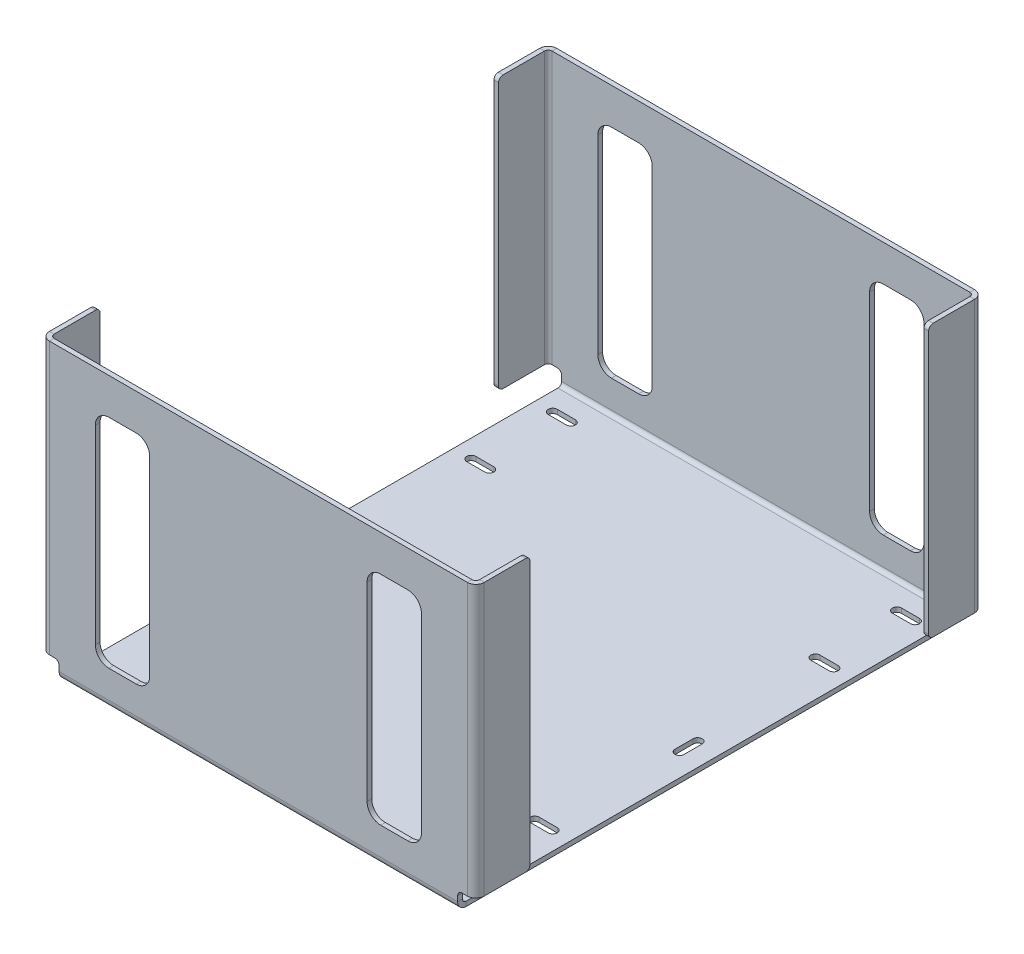
from build123d import *

# Parameters (mm, degrees)
SKETCH1_W                       = 279.4
SKETCH1_H                       = 355.6
BASE_FLANGE1_DEPTH              = 3.2766
EDGE_FLANGE1_STRIP_W            = 18.42008
EDGE_FLANGE1_STRIP_H            = 3.2766
EDGE_FLANGE1_STRIP_CUT_DEPTH    = 279.4
EDGE_FLANGE1_STRIP_2_W          = 18.42008
EDGE_FLANGE1_STRIP_2_H          = 3.2766
EDGE_FLANGE1_STRIP_CUT_2_DEPTH  = 279.4
EDGE_FLANGE1_DEPTH              = 279.4
EDGE_FLANGE1_FLAT_DEPTH         = 3.2766
EDGE_FLANGE1_BEND_DEPTH         = 279.4
EDGE_FLANGE1_FLAT_2_DEPTH       = 3.2766
EDGE_FLANGE2_STRIP_W            = 18.42008
EDGE_FLANGE2_STRIP_H            = 3.2766
EDGE_FLANGE2_STRIP_CUT_DEPTH    = 190.5
EDGE_FLANGE2_STRIP_2_W          = 18.42008
EDGE_FLANGE2_STRIP_2_H          = 3.2766
EDGE_FLANGE2_STRIP_CUT_2_DEPTH  = 190.5
EDGE_FLANGE2_STRIP_3_W          = 18.42008
EDGE_FLANGE2_STRIP_3_H          = 3.2766
EDGE_FLANGE2_STRIP_CUT_3_DEPTH  = 190.5
EDGE_FLANGE2_STRIP_4_W          = 18.42008
EDGE_FLANGE2_STRIP_4_H          = 3.2766
EDGE_FLANGE2_STRIP_CUT_4_DEPTH  = 190.5
EDGE_FLANGE2_DEPTH              = 190.5
EDGE_FLANGE2_BEND_DEPTH         = 190.5
EDGE_FLANGE2_BEND_2_DEPTH       = 190.5
EDGE_FLANGE2_BEND_3_DEPTH       = 190.5
SKETCH34_W                      = 38.1
SKETCH34_H                      = 152.4
CUT_EXTRUDE1_DEPTH              = 436.484197035
FILLET1_R                       = 9.525
FILLET2_R                       = 3.175
F_1_4_START                     = -3.2766
F_1_4_0_25_DIAMETER_SLOT1_DEPTH = 3.2766
LPATTERN1_COUNT                 = 2
LPATTERN1_PITCH                 = 57.15
MIRROR1_START                   = -3.2766
MIRROR1_COPY_1_DEPTH            = 3.2766
F_1_4_0_25_DIAMETER_SLOT2_DEPTH = 3.2766


# Read off the part's stored shape, not the designer's step: 1/4 (0.25) Diameter Slot1, 1/4 (0.25) Diameter Slot2
# Sheet-metal steps are written as plain solids
with BuildPart() as part:
    # Sketch1 → Base-Flange1 (new body)
    with BuildSketch(Plane(origin=(0, 0, 0), x_dir=(1, 0, 0), z_dir=(0, 1, 0))):
        Rectangle(SKETCH1_W, SKETCH1_H)
    extrude(amount=-BASE_FLANGE1_DEPTH)

    # Edge-Flange1 strip (across the edge) → Edge-Flange1 strip cut (cut)
    with BuildSketch(Plane(origin=(-139.7, 0, 177.8), x_dir=(0, 0, -1), z_dir=(1, 0, 0))):
        with Locations((-3.2766, -1.6383)):
            Rectangle(EDGE_FLANGE1_STRIP_W, EDGE_FLANGE1_STRIP_H)
    extrude(amount=EDGE_FLANGE1_STRIP_CUT_DEPTH, mode=Mode.SUBTRACT)

    # Edge-Flange1 strip 2 (across the edge) → Edge-Flange1 strip cut 2 (cut)
    with BuildSketch(Plane(origin=(139.7, 0, -177.8), x_dir=(0, 0, 1), z_dir=(-1, 0, 0))):
        with Locations((-3.2766, -1.6383)):
            Rectangle(EDGE_FLANGE1_STRIP_2_W, EDGE_FLANGE1_STRIP_2_H)
    extrude(amount=EDGE_FLANGE1_STRIP_CUT_2_DEPTH, mode=Mode.SUBTRACT)

    # Edge-Flange1 bend section (across the edge) → Edge-Flange1 (add)
    with BuildSketch(Plane(origin=(-139.7, 0, 177.8), x_dir=(0, 0, -1), z_dir=(1, 0, 0))):
        with BuildLine():
            Line((0, 2.65684), (3.2766, 2.65684))
            ThreePointArc((3.2766, 2.65684), (4.054770419, 0.778170419), (5.93344, 0))
            Line((5.93344, 0), (5.93344, -3.2766))
            ThreePointArc((5.93344, -3.2766), (1.73786434, -1.53873566), (0, 2.65684))
        make_face()
    extrude(amount=EDGE_FLANGE1_DEPTH)

    # Edge-Flange1 profile (on flange) → Edge-Flange1 flat (add)
    with BuildSketch(Plane.XY.offset(177.8)):
        Polygon((-139.7, 2.65684), (139.7, 2.65684), (139.7, 9.4234), (152.4, 9.4234), (152.4, 199.9234), (-152.4, 199.9234), (-152.4, 9.4234), (-139.7, 9.4234), align=None)
    extrude(amount=-EDGE_FLANGE1_FLAT_DEPTH)

    # Edge-Flange1 bend section 2 (across the edge) → Edge-Flange1 bend (add)
    with BuildSketch(Plane(origin=(139.7, 0, -177.8), x_dir=(0, 0, 1), z_dir=(-1, 0, 0))):
        with BuildLine():
            Line((0, 2.65684), (3.2766, 2.65684))
            ThreePointArc((3.2766, 2.65684), (4.054770419, 0.778170419), (5.93344, 0))
            Line((5.93344, 0), (5.93344, -3.2766))
            ThreePointArc((5.93344, -3.2766), (1.73786434, -1.53873566), (0, 2.65684))
        make_face()
    extrude(amount=EDGE_FLANGE1_BEND_DEPTH)

    # Edge-Flange1 profile 2 (on flange) → Edge-Flange1 flat 2 (add)
    with BuildSketch(Plane(origin=(0, 0, -177.8), x_dir=(-1, 0, 0), z_dir=(0, 0, -1))):
        Polygon((-139.7, 9.4234), (-139.7, 2.65684), (139.7, 2.65684), (139.7, 9.4234), (152.4, 9.4234), (152.4, 199.9234), (-152.4, 199.9234), (-152.4, 9.4234), align=None)
    extrude(amount=-EDGE_FLANGE1_FLAT_2_DEPTH)

    # Edge-Flange2 strip (across the edge) → Edge-Flange2 strip cut (cut)
    with BuildSketch(Plane(origin=(-152.4, 9.4234, 174.5234), x_dir=(1, 0, 0), z_dir=(0, 1, 0))):
        with Locations((-3.2766, -1.6383)):
            Rectangle(EDGE_FLANGE2_STRIP_W, EDGE_FLANGE2_STRIP_H)
    extrude(amount=EDGE_FLANGE2_STRIP_CUT_DEPTH, mode=Mode.SUBTRACT)

    # Edge-Flange2 strip 2 (across the edge) → Edge-Flange2 strip cut 2 (cut)
    with BuildSketch(Plane(origin=(152.4, 199.9234, 174.5234), x_dir=(-1, 0, 0), z_dir=(0, -1, 0))):
        with Locations((-3.2766, -1.6383)):
            Rectangle(EDGE_FLANGE2_STRIP_2_W, EDGE_FLANGE2_STRIP_2_H)
    extrude(amount=EDGE_FLANGE2_STRIP_CUT_2_DEPTH, mode=Mode.SUBTRACT)

    # Edge-Flange2 strip 3 (across the edge) → Edge-Flange2 strip cut 3 (cut)
    with BuildSketch(Plane(origin=(-152.4, 199.9234, -174.5234), x_dir=(1, 0, 0), z_dir=(0, -1, 0))):
        with Locations((-3.2766, -1.6383)):
            Rectangle(EDGE_FLANGE2_STRIP_3_W, EDGE_FLANGE2_STRIP_3_H)
    extrude(amount=EDGE_FLANGE2_STRIP_CUT_3_DEPTH, mode=Mode.SUBTRACT)

    # Edge-Flange2 strip 4 (across the edge) → Edge-Flange2 strip cut 4 (cut)
    with BuildSketch(Plane(origin=(152.4, 9.4234, -174.5234), x_dir=(-1, 0, 0), z_dir=(0, 1, 0))):
        with Locations((-3.2766, -1.6383)):
            Rectangle(EDGE_FLANGE2_STRIP_4_W, EDGE_FLANGE2_STRIP_4_H)
    extrude(amount=EDGE_FLANGE2_STRIP_CUT_4_DEPTH, mode=Mode.SUBTRACT)

    # Edge-Flange2 section (across the edge) → Edge-Flange2 (add)
    with BuildSketch(Plane(origin=(-152.4, 9.4234, 174.5234), x_dir=(1, 0, 0), z_dir=(0, 1, 0))):
        with BuildLine():
            Line((0, 2.65684), (0, 34.8234))
            Line((0, 34.8234), (3.2766, 34.8234))
            Line((3.2766, 34.8234), (3.2766, 2.65684))
            ThreePointArc((3.2766, 2.65684), (4.054770419, 0.778170419), (5.93344, 0))
            Line((5.93344, 0), (5.93344, -3.2766))
            ThreePointArc((5.93344, -3.2766), (1.73786434, -1.53873566), (0, 2.65684))
        make_face()
    extrude(amount=EDGE_FLANGE2_DEPTH)

    # Edge-Flange2 section 2 (across the edge) → Edge-Flange2 bend (add)
    with BuildSketch(Plane(origin=(152.4, 199.9234, 174.5234), x_dir=(-1, 0, 0), z_dir=(0, -1, 0))):
        with BuildLine():
            Line((0, 2.65684), (0, 34.8234))
            Line((0, 34.8234), (3.2766, 34.8234))
            Line((3.2766, 34.8234), (3.2766, 2.65684))
            ThreePointArc((3.2766, 2.65684), (4.054770419, 0.778170419), (5.93344, 0))
            Line((5.93344, 0), (5.93344, -3.2766))
            ThreePointArc((5.93344, -3.2766), (1.73786434, -1.53873566), (0, 2.65684))
        make_face()
    extrude(amount=EDGE_FLANGE2_BEND_DEPTH)

    # Edge-Flange2 section 3 (across the edge) → Edge-Flange2 bend 2 (add)
    with BuildSketch(Plane(origin=(-152.4, 199.9234, -174.5234), x_dir=(1, 0, 0), z_dir=(0, -1, 0))):
        with BuildLine():
            Line((0, 2.65684), (0, 34.8234))
            Line((0, 34.8234), (3.2766, 34.8234))
            Line((3.2766, 34.8234), (3.2766, 2.65684))
            ThreePointArc((3.2766, 2.65684), (4.054770419, 0.778170419), (5.93344, 0))
            Line((5.93344, 0), (5.93344, -3.2766))
            ThreePointArc((5.93344, -3.2766), (1.73786434, -1.53873566), (0, 2.65684))
        make_face()
    extrude(amount=EDGE_FLANGE2_BEND_2_DEPTH)

    # Edge-Flange2 section 4 (across the edge) → Edge-Flange2 bend 3 (add)
    with BuildSketch(Plane(origin=(152.4, 9.4234, -174.5234), x_dir=(-1, 0, 0), z_dir=(0, 1, 0))):
        with BuildLine():
            Line((0, 2.65684), (0, 34.8234))
            Line((0, 34.8234), (3.2766, 34.8234))
            Line((3.2766, 34.8234), (3.2766, 2.65684))
            ThreePointArc((3.2766, 2.65684), (4.054770419, 0.778170419), (5.93344, 0))
            Line((5.93344, 0), (5.93344, -3.2766))
            ThreePointArc((5.93344, -3.2766), (1.73786434, -1.53873566), (0, 2.65684))
        make_face()
    extrude(amount=EDGE_FLANGE2_BEND_3_DEPTH)

    # Sketch34 → Cut-Extrude1 (cut, through all)
    with BuildSketch(Plane.XY.offset(177.8)):
        with Locations((-95.25, 98.3234)):
            Rectangle(SKETCH34_W, SKETCH34_H)
        with Locations((95.25, 98.3234)):
            Rectangle(SKETCH34_W, SKETCH34_H)
    extrude(amount=-CUT_EXTRUDE1_DEPTH, mode=Mode.SUBTRACT)

    # Fillet1
    fillet1_edges = [part.edges().sort_by_distance(p)[0] for p in [
        (-76.2, 174.5234, -176.1617),
        (-76.2, 22.1234, -176.1617),
        (-114.3, 22.1234, -176.1617),
        (-114.3, 174.5234, -176.1617),
        (-76.2, 174.5234, 176.1617),
        (-76.2, 22.1234, 176.1617),
        (-114.3, 22.1234, 176.1617),
        (-114.3, 174.5234, 176.1617),
        (76.2, 22.1234, -176.1617),
        (76.2, 174.5234, -176.1617),
        (114.3, 174.5234, -176.1617),
        (114.3, 22.1234, -176.1617),
        (76.2, 22.1234, 176.1617),
        (76.2, 174.5234, 176.1617),
        (114.3, 174.5234, 176.1617),
        (114.3, 22.1234, 176.1617),
    ]]
    fillet(fillet1_edges, radius=FILLET1_R)

    # Fillet2
    fillet2_edges = [part.edges().sort_by_distance(p)[0] for p in [
        (-150.7617, 9.4234, 139.7),
        (-150.7617, 199.9234, 139.7),
        (150.7617, 199.9234, 139.7),
        (150.7617, 9.4234, 139.7),
        (-150.7617, 199.9234, -139.7),
        (-150.7617, 9.4234, -139.7),
        (150.7617, 9.4234, -139.7),
        (150.7617, 199.9234, -139.7),
        (-139.7, 9.4234, 176.1617),
        (139.7, 9.4234, 176.1617),
        (139.7, 9.4234, -176.1617),
        (-139.7, 9.4234, -176.1617),
    ]]
    fillet(fillet2_edges, radius=FILLET2_R)

    # 1/4 (0.25) Diameter Slot1 outline → 1/4 (0.25) Diameter Slot1 (cut)
    with BuildSketch(Plane(origin=(0, 0, 0), x_dir=(1, 0, 0), z_dir=(0, 1, 0)).offset(F_1_4_START)):
        with BuildLine():
            ThreePointArc((-114.3, 152.4), (-111.125, 155.575), (-114.3, 158.75))
            Line((-114.3, 158.75), (-127, 158.75))
            ThreePointArc((-127, 158.75), (-130.175, 155.575), (-127, 152.4))
            Line((-127, 152.4), (-114.3, 152.4))
        make_face()
        with BuildLine():
            ThreePointArc((114.3, 158.75), (111.125, 155.575), (114.3, 152.4))
            Line((114.3, 152.4), (127, 152.4))
            ThreePointArc((127, 152.4), (130.175, 155.575), (127, 158.75))
            Line((127, 158.75), (114.3, 158.75))
        make_face()
    f_1_4_0_25_diameter_slot1 = extrude(amount=F_1_4_0_25_DIAMETER_SLOT1_DEPTH, mode=Mode.SUBTRACT)

    # LPattern1: 1/4 (0.25) Diameter Slot1 ×2
    with Locations(*[(0, 0, i * LPATTERN1_PITCH) for i in range(1, LPATTERN1_COUNT)]):
        add(f_1_4_0_25_diameter_slot1, mode=Mode.SUBTRACT)

    # Mirror1: 1/4 (0.25) Diameter Slot1 across plane
    add(f_1_4_0_25_diameter_slot1.mirror(Plane.XY), mode=Mode.SUBTRACT)

    # Mirror1 copy 1 sketch → Mirror1 copy 1 (cut)
    with BuildSketch(Plane(origin=(0, 0, -57.15), x_dir=(1, 0, 0), z_dir=(0, 1, 0)).offset(MIRROR1_START)):
        with BuildLine():
            ThreePointArc((-114.3, -152.4), (-111.125, -155.575), (-114.3, -158.75))
            Line((-114.3, -158.75), (-127, -158.75))
            ThreePointArc((-127, -158.75), (-130.175, -155.575), (-127, -152.4))
            Line((-127, -152.4), (-114.3, -152.4))
        make_face()
        with BuildLine():
            ThreePointArc((114.3, -158.75), (111.125, -155.575), (114.3, -152.4))
            Line((114.3, -152.4), (127, -152.4))
            ThreePointArc((127, -152.4), (130.175, -155.575), (127, -158.75))
            Line((127, -158.75), (114.3, -158.75))
        make_face()
    extrude(amount=MIRROR1_COPY_1_DEPTH, mode=Mode.SUBTRACT)

    # 1/4 (0.25) Diameter Slot2 outline → 1/4 (0.25) Diameter Slot2 (cut)
    with BuildSketch(Plane(origin=(0, 0, 0), x_dir=(1, 0, 0), z_dir=(0, 1, 0)).offset(F_1_4_START)):
        with BuildLine():
            ThreePointArc((-120.65, 6.35), (-123.825, 9.525), (-127, 6.35))
            Line((-127, 6.35), (-127, -6.35))
            ThreePointArc((-127, -6.35), (-123.825, -9.525), (-120.65, -6.35))
            Line((-120.65, -6.35), (-120.65, 6.35))
        make_face()
        with BuildLine():
            ThreePointArc((127, 6.35), (123.825, 9.525), (120.65, 6.35))
            Line((120.65, 6.35), (120.65, -6.35))
            ThreePointArc((120.65, -6.35), (123.825, -9.525), (127, -6.35))
            Line((127, -6.35), (127, 6.35))
        make_face()
    extrude(amount=F_1_4_0_25_DIAMETER_SLOT2_DEPTH, mode=Mode.SUBTRACT)


solid = part.part
